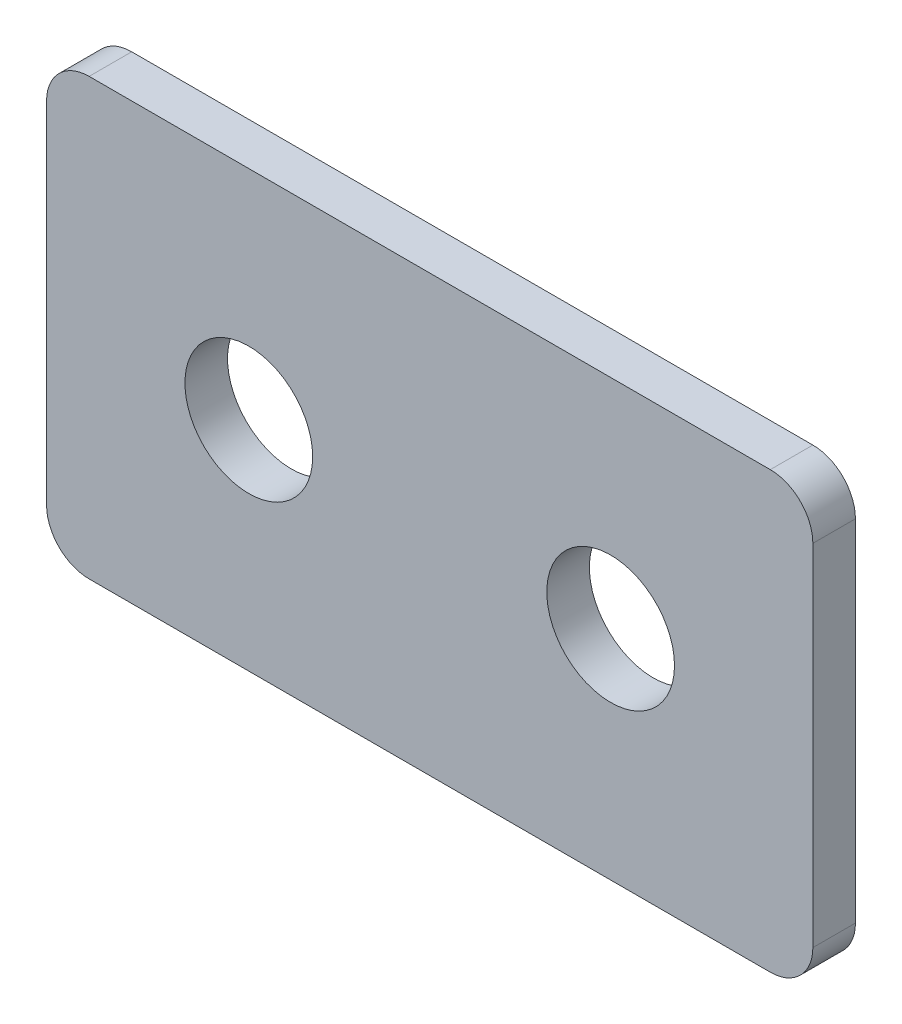
from build123d import *

# Parameters (mm, degrees)
SKETCH1_R           = 4.7625
BOSS_EXTRUDE1_DEPTH = 3.175


with BuildPart() as part:
    # Sketch1 → Boss-Extrude1 (new body)
    with BuildSketch(Plane.XY):
        with BuildLine():
            Line((38.89375, -16.2306), (-11.90625, -16.2306))
            ThreePointArc((-11.90625, -16.2306), (-14.15131403, -15.30066403), (-15.08125, -13.0556))
            Line((-15.08125, -13.0556), (-15.08125, 13.0556))
            ThreePointArc((-15.08125, 13.0556), (-14.15131403, 15.30066403), (-11.90625, 16.2306))
            Line((-11.90625, 16.2306), (38.89375, 16.2306))
            ThreePointArc((38.89375, 16.2306), (41.13881403, 15.30066403), (42.06875, 13.0556))
            Line((42.06875, 13.0556), (42.06875, -13.0556))
            ThreePointArc((42.06875, -13.0556), (41.13881403, -15.30066403), (38.89375, -16.2306))
        make_face()
        Circle(SKETCH1_R, mode=Mode.SUBTRACT)
        with Locations((26.9875, 0)):
            Circle(SKETCH1_R, mode=Mode.SUBTRACT)
    extrude(amount=BOSS_EXTRUDE1_DEPTH)


solid = part.part
